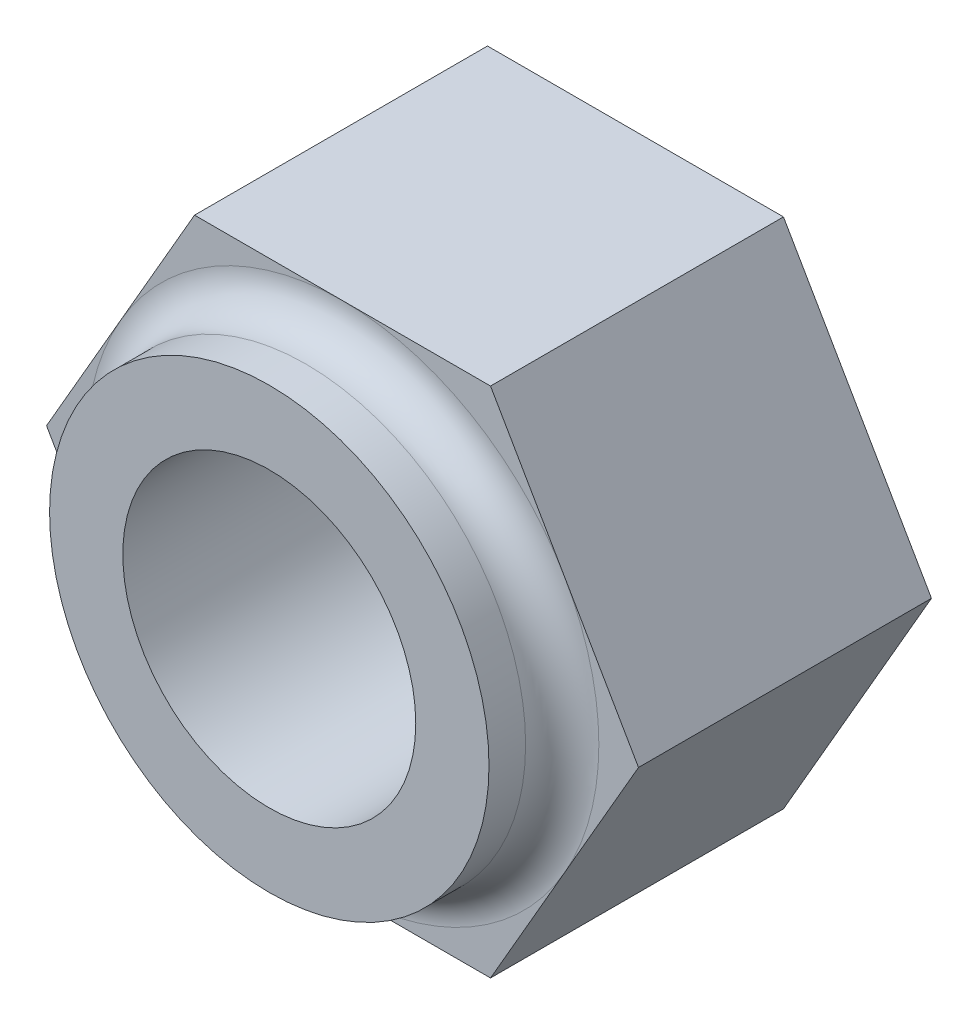
from build123d import *

# Parameters (mm, degrees)
SKETCH_1_R          = 2
EXTRUDE_1_DEPTH     = 5
SKETCH_2_R          = 3
CUT_EXTRUDE_1_DEPTH = 1
FILLET_1_R          = 0.5


with BuildPart() as part:
    # 草图1 → 凸台-拉伸1 (new body)
    with BuildSketch(Plane.XY):
        Polygon((4.041451884, 0), (2.020725942, 3.5), (-2.020725942, 3.5), (-4.041451884, 0), (-2.020725942, -3.5), (2.020725942, -3.5), align=None)
        Circle(SKETCH_1_R, mode=Mode.SUBTRACT)
    extrude(amount=EXTRUDE_1_DEPTH)

    # 草图2 → 切除-拉伸1 (cut)
    with BuildSketch(Plane.XY.offset(5)):
        Polygon((4.041451884, 0), (2.020725942, 3.5), (-2.020725942, 3.5), (-4.041451884, 0), (-2.020725942, -3.5), (2.020725942, -3.5), align=None)
        Circle(SKETCH_2_R, mode=Mode.SUBTRACT)
    extrude(amount=-CUT_EXTRUDE_1_DEPTH, mode=Mode.SUBTRACT)

    # 圆角1
    fillet_1_edges = [part.edges().sort_by_distance(p)[0] for p in [
        (-3, 0, 4),
    ]]
    fillet(fillet_1_edges, radius=FILLET_1_R - 0.0001)  # a hair under: the kernel refuses the full size


solid = part.part
